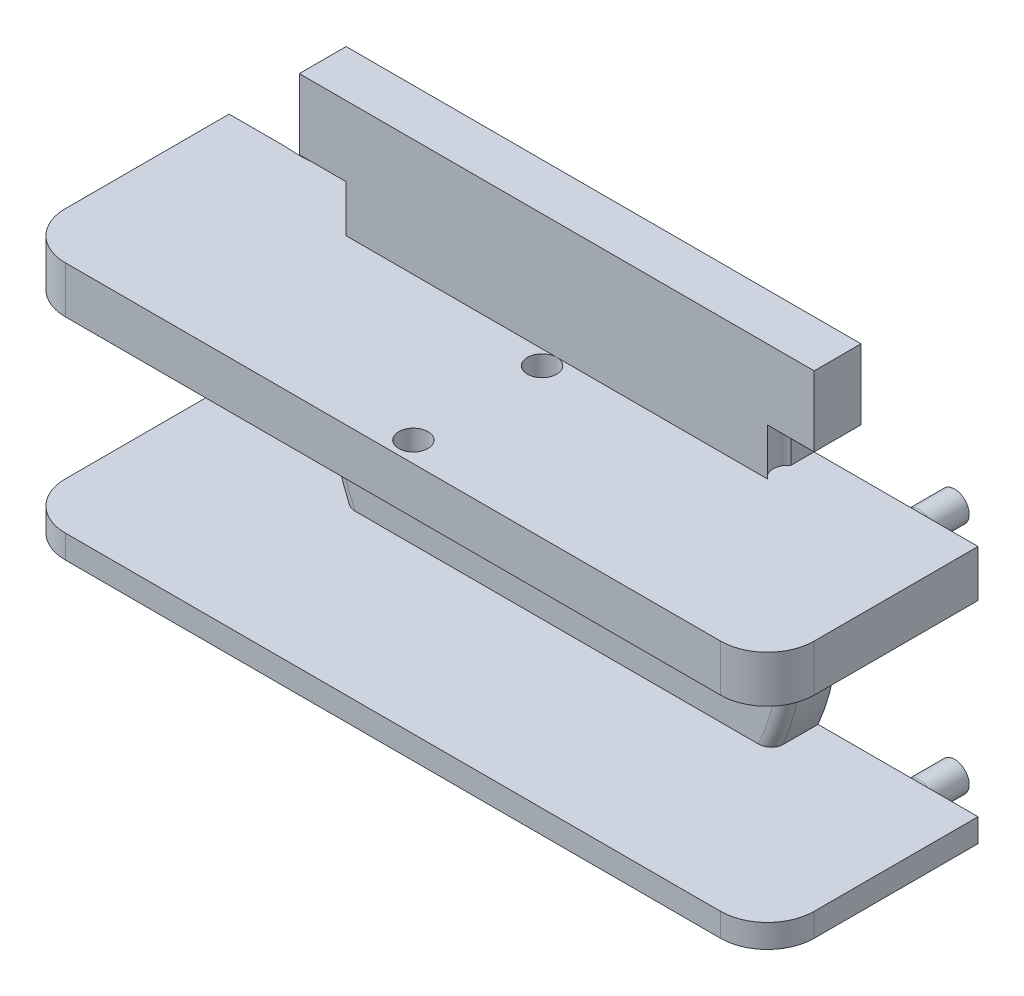
from build123d import *

# Parameters (mm, degrees)
BOSS_EXTRUDE1_DEPTH     = 2
SKETCH2_R               = 1.51
BOSS_EXTRUDE2_DEPTH     = 4
SKETCH3_R               = 3.5
BOSS_EXTRUDE3_DEPTH     = 1
SKETCH4_W               = 2
SKETCH4_H               = 17
BOSS_EXTRUDE4_DEPTH     = 0.001
SKETCH5_W               = 18
SKETCH5_H               = 2
BOSS_EXTRUDE5_DEPTH     = 0.001
SKETCH6_W               = 2.001
SKETCH6_H               = 2
BOSS_EXTRUDE6_DEPTH     = 5
BOSS_EXTRUDE7_DEPTH     = 0.001
CUT_EXTRUDE1_DEPTH      = 20.519323784
SKETCH9_W               = 2.937742252
SKETCH9_H               = 8
CUT_EXTRUDE2_DEPTH      = 0.001
CUT_EXTRUDE11_START     = -0.001
SKETCH21_R              = 9.75
SKETCH21_R_2            = 3.5
CUT_EXTRUDE11_DEPTH     = 0.001
SKETCH10_W              = 32
SKETCH10_H              = 2
BOSS_EXTRUDE8_DEPTH     = 7
FILLET1_R               = 0.5
SKETCH11_R              = 0.625
BOSS_EXTRUDE9_DEPTH     = 2
SKETCH14_W              = 2
SKETCH14_H              = 2
CUT_EXTRUDE5_DEPTH      = 22.401355237
SKETCH12_R              = 0.675
CUT_EXTRUDE3_DEPTH      = 2.5
CUT_EXTRUDE6_DEPTH      = 2
FILLET2_R               = 0.5
FILLET3_R               = 0.5
FILLET4_R               = 2
CUT_EXTRUDE7_DEPTH      = 26.019992106
CUT_EXTRUDE7_DEPTH_BACK = 1
SKETCH19_R              = 0.625
CUT_EXTRUDE9_DEPTH      = 2


with BuildPart() as part:
    # Sketch1 → Boss-Extrude1 (new body)
    with BuildSketch(Plane.XY):
        Polygon((-11, 6), (-11, 11), (11, 11), (11, 6), (11, -6), (-11, -6), align=None)
    extrude(amount=BOSS_EXTRUDE1_DEPTH)

    # Sketch3 → Boss-Extrude3 (add)
    with BuildSketch(Plane(origin=(0, 0, 0), x_dir=(-1, 0, 0), z_dir=(0, 0, -1))):
        with Locations(Location((0, 0, 0), (0, 0, 180))):
            Circle(SKETCH3_R)
    extrude(amount=BOSS_EXTRUDE3_DEPTH)

    # Sketch4 → Boss-Extrude4 (add)
    with BuildSketch(Plane(origin=(0, 0, 0), x_dir=(-1, 0, 0), z_dir=(0, 0, -1))):
        with Locations((10, 2.5)):
            Rectangle(SKETCH4_W, SKETCH4_H)
        with Locations((-10, 2.5)):
            Rectangle(SKETCH4_W, SKETCH4_H)
    extrude(amount=BOSS_EXTRUDE4_DEPTH)

    # Sketch5 → Boss-Extrude5 (add)
    with BuildSketch(Plane(origin=(0, 0, 0), x_dir=(-1, 0, 0), z_dir=(0, 0, -1))):
        with Locations((0, 10)):
            Rectangle(SKETCH5_W, SKETCH5_H)
    extrude(amount=BOSS_EXTRUDE5_DEPTH)

    # Sketch6 → Boss-Extrude6 (add)
    with BuildSketch(Plane(origin=(11, 0, 0), x_dir=(0, 0, -1), z_dir=(1, 0, 0))):
        with Locations((-0.9995, -5)):
            Rectangle(SKETCH6_W, SKETCH6_H)
        with Locations((-0.9995, 5)):
            Rectangle(SKETCH6_W, SKETCH6_H)
    boss_extrude6 = extrude(amount=BOSS_EXTRUDE6_DEPTH)

    # Mirror1: Boss-Extrude6 across plane
    add(boss_extrude6.mirror(Plane(origin=(0, 0, 0), x_dir=(0, 0, 1), z_dir=(1, 0, 0))))

    # Sketch7 → Boss-Extrude7 (add)
    with BuildSketch(Plane(origin=(0, 0, -0.001), x_dir=(-1, 0, 0), z_dir=(0, 0, -1))):
        with BuildLine():
            ThreePointArc((-6.708203932, -6), (-8.407551231, -3.211398808), (-9, 0))
            Line((-9, 0), (-9, -6))
            Line((-9, -6), (-6.708203932, -6))
        make_face()
        with BuildLine():
            Line((-9, 9), (-9, 0))
            ThreePointArc((-9, 0), (-6.363961031, 6.363961031), (0, 9))
            Line((0, 9), (-9, 9))
        make_face()
    boss_extrude7 = extrude(amount=-BOSS_EXTRUDE7_DEPTH)

    # Sketch8 → Cut-Extrude1 (cut, through all)
    with BuildSketch(Plane(origin=(0, 0, -0.001), x_dir=(-1, 0, 0), z_dir=(0, 0, -1))):
        with BuildLine():
            Line((-11, 4), (-9.16515139, 4))
            ThreePointArc((-9.16515139, 4), (-10, 0), (-9.16515139, -4))
            Line((-9.16515139, -4), (-11, -4))
            Line((-11, -4), (-11, 4))
        make_face()
    cut_extrude1 = extrude(amount=-CUT_EXTRUDE1_DEPTH, mode=Mode.SUBTRACT)

    # Sketch9 → Cut-Extrude2 (cut)
    with BuildSketch(Plane(origin=(0, 0, -0.001), x_dir=(-1, 0, 0), z_dir=(0, 0, -1))):
        with Locations((-9.531128874, 0)):
            Rectangle(SKETCH9_W, SKETCH9_H)
    cut_extrude2 = extrude(amount=-CUT_EXTRUDE2_DEPTH, mode=Mode.SUBTRACT)

    # Mirror2: Boss-Extrude7, Cut-Extrude1, Cut-Extrude2 across plane
    add(boss_extrude7.mirror(Plane(origin=(0, 0, 0), x_dir=(0, 0, 1), z_dir=(1, 0, 0))))
    add(cut_extrude1.mirror(Plane(origin=(0, 0, 0), x_dir=(0, 0, 1), z_dir=(1, 0, 0))), mode=Mode.SUBTRACT)
    add(cut_extrude2.mirror(Plane(origin=(0, 0, 0), x_dir=(0, 0, 1), z_dir=(1, 0, 0))), mode=Mode.SUBTRACT)

    # Sketch21 → Cut-Extrude11 (cut)
    with BuildSketch(Plane(origin=(0, 0, -0.001), x_dir=(-1, 0, 0), z_dir=(0, 0, -1)).offset(CUT_EXTRUDE11_START)):
        Circle(SKETCH21_R)
        with Locations(Location((0, 0, 0), (0, 0, 180))):
            Circle(SKETCH21_R_2, mode=Mode.SUBTRACT)
    extrude(amount=CUT_EXTRUDE11_DEPTH, mode=Mode.SUBTRACT)

    # Sketch10 → Boss-Extrude8 (add)
    with BuildSketch(Plane.XY.offset(2)):
        with Locations((0, -5)):
            Rectangle(SKETCH10_W, SKETCH10_H)
        with Locations((0, 5)):
            Rectangle(SKETCH10_W, SKETCH10_H)
    extrude(amount=BOSS_EXTRUDE8_DEPTH)

    # Fillet1
    fillet1_edges = [part.edges().sort_by_distance(p)[0] for p in [
        (10, 0, 2),
        (-10, 0, 2),
    ]]
    fillet(fillet1_edges, radius=FILLET1_R)

    # Sketch11 → Boss-Extrude9 (add)
    with BuildSketch(Plane(origin=(0, 0, -0.001), x_dir=(-1, 0, 0), z_dir=(0, 0, -1))):
        with Locations(Location((-13, -5, 0), (0, 0, 180))):
            Circle(SKETCH11_R)
    boss_extrude9 = extrude(amount=BOSS_EXTRUDE9_DEPTH)

    # Sketch14 → Cut-Extrude5 (cut, through all)
    with BuildSketch(Plane(origin=(0, 0, -0.001), x_dir=(-1, 0, 0), z_dir=(0, 0, -1))):
        with Locations((10, 7)):
            Rectangle(SKETCH14_W, SKETCH14_H)
        with Locations((-10, 7)):
            Rectangle(SKETCH14_W, SKETCH14_H)
    extrude(amount=-CUT_EXTRUDE5_DEPTH, mode=Mode.SUBTRACT)

    # Sketch12 → Cut-Extrude3 (cut)
    with BuildSketch(Plane(origin=(0, 0, -0.001), x_dir=(-1, 0, 0), z_dir=(0, 0, -1))):
        with Locations((13, -5)):
            Circle(SKETCH12_R)
    cut_extrude3 = extrude(amount=-CUT_EXTRUDE3_DEPTH, mode=Mode.SUBTRACT)

    # Sketch16 → Cut-Extrude6 (cut)
    with BuildSketch(Plane(origin=(0, 6, 0), x_dir=(1, 0, 0), z_dir=(0, 1, 0))):
        with BuildLine():
            Line((-9, -1), (-9, -2))
            ThreePointArc((-9, -2), (-8.75, -1.5), (-9, -1))
        make_face()
    cut_extrude6 = extrude(amount=CUT_EXTRUDE6_DEPTH, mode=Mode.SUBTRACT)

    # Mirror3: Boss-Extrude9, Cut-Extrude3 across plane
    add(boss_extrude9.mirror(Plane.ZX))
    add(cut_extrude3.mirror(Plane.ZX), mode=Mode.SUBTRACT)

    # Mirror4: Cut-Extrude6 across plane
    add(cut_extrude6.mirror(Plane(origin=(0, 0, 0), x_dir=(0, 0, 1), z_dir=(1, 0, 0))), mode=Mode.SUBTRACT)

    # Fillet2
    fillet2_edges = [part.edges().sort_by_distance(p)[0] for p in [
        (12.375, -5, -0.001),
        (12.375, 5, -0.001),
    ]]
    fillet(fillet2_edges, radius=FILLET2_R)

    # Fillet3
    # the kernel refuses this fillet: 0.5 mm, written as the material it takes off along each edge
    with BuildSketch(Plane(origin=(-13, -5, -0.001), x_dir=(-1, 0, 0), z_dir=(0, -1, 0))) as fillet3_piece_1:
        with BuildLine():
            CenterArc((0.675 + FILLET3_R, -FILLET3_R), FILLET3_R, 90, 90)
            Line((0.675, -FILLET3_R), (0.675, 0))
            Line((0.675, 0), (0.675 + FILLET3_R, 0))
        make_face()
    revolve(axis=Axis((-13, -5, -0.001), (0, 0, -1)), mode=Mode.SUBTRACT)
    with BuildSketch(Plane(origin=(-13, 5, -0.001), x_dir=(-1, 0, 0), z_dir=(0, 1, 0))) as fillet3_piece_2:
        with BuildLine():
            CenterArc((0.675 + FILLET3_R, FILLET3_R), FILLET3_R, 180, 90)
            Line((0.675, FILLET3_R), (0.675, 0))
            Line((0.675, 0), (0.675 + FILLET3_R, 0))
        make_face()
    revolve(axis=Axis((-13, 5, -0.001), (0, 0, 1)), mode=Mode.SUBTRACT)

    # Fillet4
    fillet4_edges = [part.edges().sort_by_distance(p)[0] for p in [
        (16, -5, 9),
        (-16, -5, 9),
        (-16, 5, 9),
        (16, 5, 9),
    ]]
    fillet(fillet4_edges, radius=FILLET4_R)

    # Sketch17 → Cut-Extrude7 (cut, two sides: drawn at the far end of the back side and taken through both)
    with BuildSketch(Plane.XZ.offset(6).offset(-CUT_EXTRUDE7_DEPTH_BACK)):
        with BuildLine():
            Line((-16, 7), (-16, -0.001))
            Line((-16, -0.001), (-14.5, -0.001))
            Line((-14.5, -0.001), (-14.5, 7))
            ThreePointArc((-14.5, 7), (-14.353553391, 7.353553391), (-14, 7.5))
            Line((-14, 7.5), (14, 7.5))
            ThreePointArc((14, 7.5), (14.353553391, 7.353553391), (14.5, 7))
            Line((14.5, 7), (14.5, -0.001))
            Line((14.5, -0.001), (16, -0.001))
            Line((16, -0.001), (16, 7))
            ThreePointArc((16, 7), (15.414213562, 8.414213562), (14, 9))
            Line((14, 9), (-14, 9))
            ThreePointArc((-14, 9), (-15.414213562, 8.414213562), (-16, 7))
        make_face()
    extrude(amount=CUT_EXTRUDE7_DEPTH + CUT_EXTRUDE7_DEPTH_BACK, mode=Mode.SUBTRACT)

    # Sketch19 → Cut-Extrude9 (cut)
    with BuildSketch(Plane(origin=(0, 6, 0), x_dir=(1, 0, 0), z_dir=(0, 1, 0))):
        with Locations(Location((0, -2.625, 0), (0, 0, 90))):
            Circle(SKETCH19_R)
        with Locations(Location((0, -8.125, 0), (0, 0, 270))):
            Circle(SKETCH19_R)
    extrude(amount=-CUT_EXTRUDE9_DEPTH, mode=Mode.SUBTRACT)


with BuildPart() as body_2:
    # Sketch2 → Boss-Extrude2 (new body)
    with BuildSketch(Plane(origin=(0, 0, 2), x_dir=(-1, 0, 0), z_dir=(0, 0, -1))):
        Circle(SKETCH2_R)
    extrude(amount=BOSS_EXTRUDE2_DEPTH)


with BuildPart() as part_1:
    add(part.part)

    # Combine2: cut body 2
    add(body_2.part, mode=Mode.SUBTRACT)


solid = part_1.part
